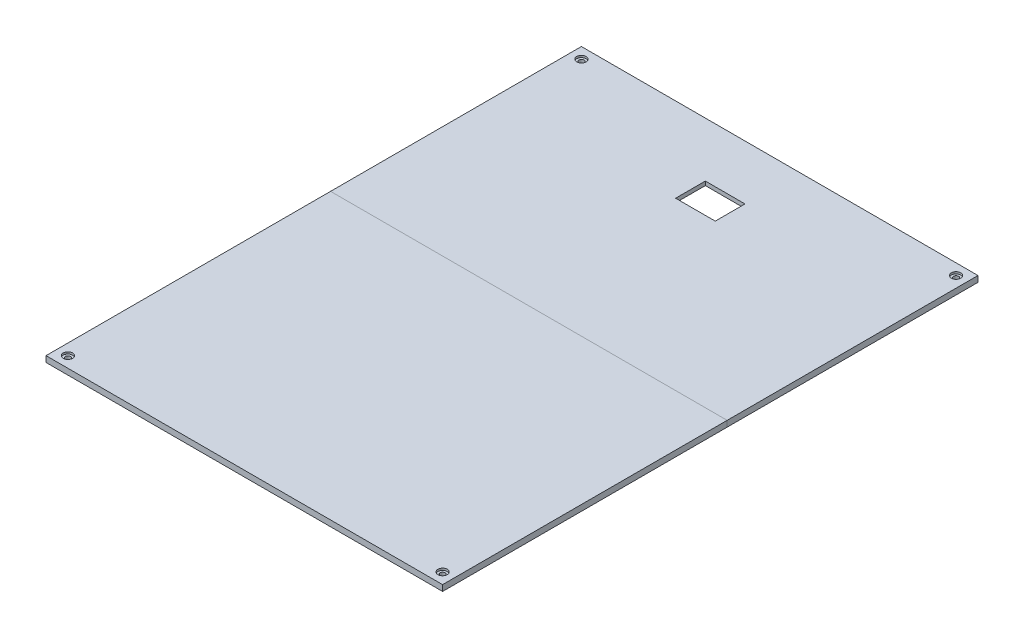
from build123d import *

# Parameters (mm, degrees)
SKETCH_1_W          = 200
SKETCH_1_H          = 270
EXTRUDE_1_DEPTH     = 3
SKETCH_2_R          = 1.3
CUT_EXTRUDE_1_DEPTH = 169.029759269
SKETCH_3_R          = 2.375
CUT_EXTRUDE_2_DEPTH = 1
SKETCH_4_W          = 20
SKETCH_4_H          = 15
CUT_EXTRUDE_3_DEPTH = 169.029759269
SKETCH_5_R          = 2.75
SKETCH_5_R_2        = 1.75
EXTRUDE_2_DEPTH     = 2.8
CHAMFER_1_SIZE      = 1


with BuildPart() as part:
    # Эскиз1 → Бобышка-Вытянуть1 (new body)
    with BuildSketch(Plane(origin=(0, 0, 0), x_dir=(1, 0, 0), z_dir=(0, 1, 0))):
        Rectangle(SKETCH_1_W, SKETCH_1_H)
    extrude(amount=EXTRUDE_1_DEPTH)

    # Эскиз2 → Вырез-Вытянуть1 (cut, through all)
    with BuildSketch(Plane(origin=(0, 3, 0), x_dir=(1, 0, 0), z_dir=(0, 1, 0))):
        with Locations((-94.474873734, 129.474873734)):
            Circle(SKETCH_2_R)
        with Locations((94.474873734, 129.474873734)):
            Circle(SKETCH_2_R)
        with Locations((94.474873734, -129.474873734)):
            Circle(SKETCH_2_R)
        with Locations((-94.474873734, -129.474873734)):
            Circle(SKETCH_2_R)
    extrude(amount=-CUT_EXTRUDE_1_DEPTH, mode=Mode.SUBTRACT)

    # Эскиз3 → Вырез-Вытянуть2 (cut)
    with BuildSketch(Plane(origin=(0, 3, 0), x_dir=(1, 0, 0), z_dir=(0, 1, 0))):
        with Locations((-94.474873734, 129.474873734)):
            Circle(SKETCH_3_R)
        with Locations((94.474873734, 129.474873734)):
            Circle(SKETCH_3_R)
        with Locations((-94.474873734, -129.474873734)):
            Circle(SKETCH_3_R)
        with Locations((94.474873734, -129.474873734)):
            Circle(SKETCH_3_R)
    extrude(amount=-CUT_EXTRUDE_2_DEPTH, mode=Mode.SUBTRACT)

    # Эскиз4 → Вырез-Вытянуть3 (cut, through all)
    with BuildSketch(Plane(origin=(0, 3, 0), x_dir=(1, 0, 0), z_dir=(0, 1, 0))):
        with Locations((0, 100)):
            Rectangle(SKETCH_4_W, SKETCH_4_H)
    extrude(amount=-CUT_EXTRUDE_3_DEPTH, mode=Mode.SUBTRACT)

    # Эскиз5 → Бобышка-Вытянуть2 (add)
    # profile 1 of 2: a face of its own
    with BuildSketch(Plane.XZ):
        with Locations((-3.9, -120.15)):
            Circle(SKETCH_5_R)
        with Locations((-3.9, -120.15)):
            Circle(SKETCH_5_R_2, mode=Mode.SUBTRACT)
    # profile 2 of 2: a face of its own
    with BuildSketch(Plane.XZ):
        with Locations((6.25, -88.45)):
            Circle(SKETCH_5_R)
        with Locations((6.25, -88.45)):
            Circle(SKETCH_5_R_2, mode=Mode.SUBTRACT)
    extrude(amount=EXTRUDE_2_DEPTH)


with BuildPart() as body_2:
    # Split Bodies 1: the piece on the far side of the plane
    add(part.part)
    split(bisect_by=Plane.XY.offset(-8.5), keep=Keep.BOTTOM)

    # Фаска1
    chamfer_1_edges = [body_2.edges().sort_by_distance(p)[0] for p in [
        (0, 0, -107.5),
        (-10, 0, -100),
        (0, 0, -92.5),
        (10, 0, -100),
    ]]
    chamfer(chamfer_1_edges, length=CHAMFER_1_SIZE)


with BuildPart() as part_1:
    add(part.part)

    # Split Bodies 1
    split(bisect_by=Plane.XY.offset(-8.5), keep=Keep.TOP)


solid = Compound([body_2.part, part_1.part])
